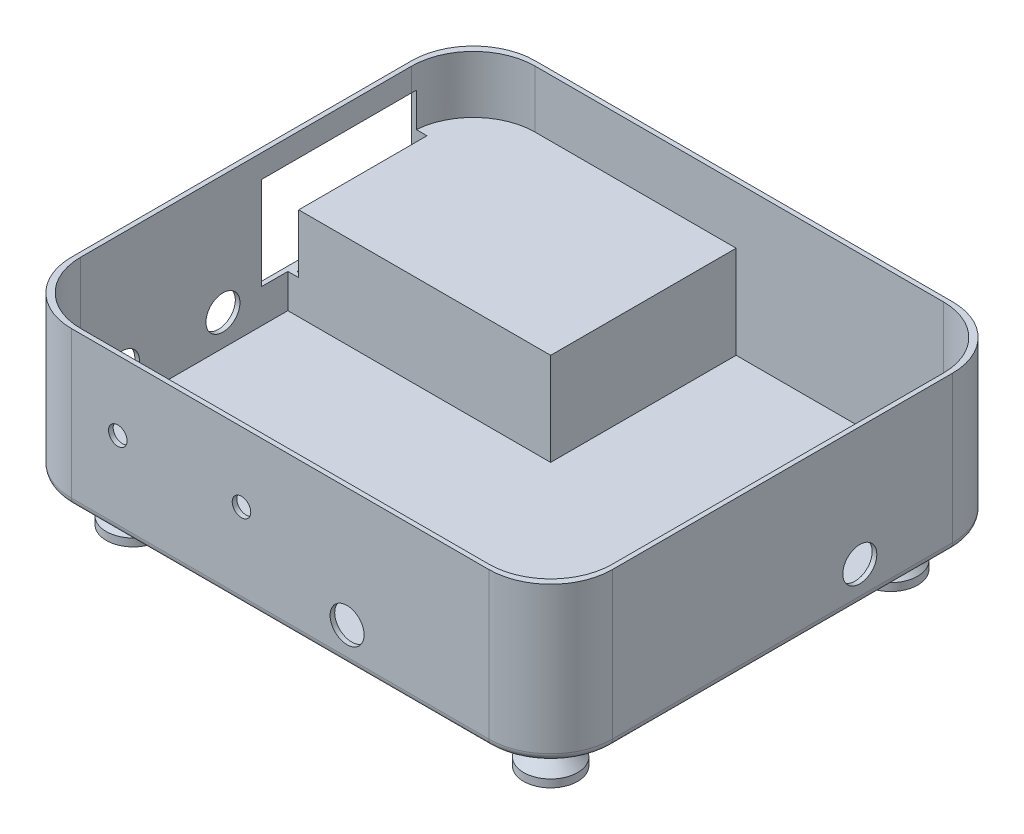
from build123d import *

# Parameters (mm, degrees)
SKETCH1_W             = 350
SKETCH1_H             = 300
BOSS_EXTRUDE1_DEPTH   = 100
SHELL1_T              = -3
SKETCH2_R             = 11
CUT_EXTRUDE1_DEPTH    = 10
SKETCH3_R             = 11
CUT_EXTRUDE2_DEPTH    = 10
SKETCH4_R             = 11
CUT_EXTRUDE3_DEPTH    = 10
FILLET1_R             = 40
FILLET2_R             = 5
SKETCH5_R             = 10
BOSS_EXTRUDE2_DEPTH   = 15
SKETCH6_R             = 17.5
BOSS_EXTRUDE3_DEPTH   = 15
CHAMFER1_SIZE         = 10
EXTRUDE_THIN1_DEPTH   = 10
EXTRUDE_THIN1_START   = 50
EXTRUDE_THIN1_2_DEPTH = 10
EXTRUDE_THIN1_START_2 = 10
EXTRUDE_THIN1_3_DEPTH = 40
SKETCH8_W             = 100
SKETCH8_H             = 60
CUT_EXTRUDE4_DEPTH    = 10
SKETCH9_R             = 6
CUT_EXTRUDE5_DEPTH    = 10


# Read off the part's stored shape, not the designer's step: Extrude-Thin1
with BuildPart() as part:
    # Sketch1 → Boss-Extrude1 (new body)
    with BuildSketch(Plane(origin=(0, 0, 0), x_dir=(1, 0, 0), z_dir=(0, 1, 0))):
        Rectangle(SKETCH1_W, SKETCH1_H)
    extrude(amount=BOSS_EXTRUDE1_DEPTH)

    # Shell1
    shell1_openings = [part.faces().sort_by_distance(p)[0] for p in [
        (0, 100, 0),
    ]]
    offset(amount=SHELL1_T, openings=shell1_openings, kind=Kind.INTERSECTION)

    # Sketch2 → Cut-Extrude1 (cut)
    with BuildSketch(Plane.ZY.offset(175)):
        with Locations((80, 23)):
            Circle(SKETCH2_R)
        with Locations((15, 23)):
            Circle(SKETCH2_R)
    extrude(amount=-CUT_EXTRUDE1_DEPTH, mode=Mode.SUBTRACT)

    # Sketch3 → Cut-Extrude2 (cut)
    with BuildSketch(Plane.XY.offset(150)):
        with Locations((43.31, 23)):
            Circle(SKETCH3_R)
    extrude(amount=-CUT_EXTRUDE2_DEPTH, mode=Mode.SUBTRACT)

    # Sketch4 → Cut-Extrude3 (cut)
    with BuildSketch(Plane(origin=(175, 0, 0), x_dir=(0, 0, -1), z_dir=(1, 0, 0))):
        with Locations((50, 23)):
            Circle(SKETCH4_R)
    extrude(amount=-CUT_EXTRUDE3_DEPTH, mode=Mode.SUBTRACT)

    # Fillet1
    fillet1_edges = [part.edges().sort_by_distance(p)[0] for p in [
        (172, 51.5, 147),
        (172, 51.5, -147),
        (-172, 51.5, -147),
        (-172, 51.5, 147),
        (175, 50, 150),
        (-175, 50, 150),
        (-175, 50, -150),
        (175, 50, -150),
    ]]
    fillet(fillet1_edges, radius=FILLET1_R)

    # Fillet2
    fillet2_edges = [part.edges().sort_by_distance(p)[0] for p in [
        (0, 0, -150),
        (175, 0, 0),
        (0, 0, 150),
        (-175, 0, 0),
        (-163.284271247, 0, 138.284271247),
        (163.284271247, 0, 138.284271247),
        (-163.284271247, 0, -138.284271247),
        (163.284271247, 0, -138.284271247),
    ]]
    fillet(fillet2_edges, radius=FILLET2_R)

    # Sketch5 → Boss-Extrude2 (add)
    with BuildSketch(Plane.XZ):
        with Locations(Location((-135, -110, 0), (0, 0, 90))):
            Circle(SKETCH5_R)
        with Locations(Location((-135, 110, 0), (0, 0, 90))):
            Circle(SKETCH5_R)
        with Locations(Location((135, -110, 0), (0, 0, 90))):
            Circle(SKETCH5_R)
        with Locations(Location((135, 110, 0), (0, 0, 90))):
            Circle(SKETCH5_R)
    extrude(amount=BOSS_EXTRUDE2_DEPTH)

    # Sketch6 → Boss-Extrude3 (add)
    with BuildSketch(Plane.XZ.offset(15)):
        with Locations(Location((135, 110, 0), (0, 0, 270))):
            Circle(SKETCH6_R)
        with Locations(Location((135, -110, 0), (0, 0, 270))):
            Circle(SKETCH6_R)
        with Locations(Location((-135, 110, 0), (0, 0, 270))):
            Circle(SKETCH6_R)
        with Locations(Location((-135, -110, 0), (0, 0, 270))):
            Circle(SKETCH6_R)
    extrude(amount=BOSS_EXTRUDE3_DEPTH)

    # Chamfer1
    # the kernel refuses this chamfer: 10 mm, written as the material it takes off along each edge
    with BuildSketch(Plane(origin=(-135, -15, -110), x_dir=(0, 0, -1), z_dir=(-1, 0, 0))) as chamfer1_piece_1_section:
        Polygon((17.5 - CHAMFER1_SIZE, 0), (17.5, CHAMFER1_SIZE), (17.5, 0), align=None)
    chamfer1_piece_1 = revolve(axis=Axis((-135, -15, -110), (0, -1, 0)), mode=Mode.PRIVATE)
    chamfer1_piece_1 = chamfer1_piece_1 - Plane(origin=(-135, -21.273186291, -110), x_dir=(0, 0, 1), z_dir=(0, 1, 0)) * Cylinder(10, 70, mode=Mode.PRIVATE)
    add(chamfer1_piece_1, mode=Mode.SUBTRACT)
    with BuildSketch(Plane(origin=(-135, -15, 110), x_dir=(0, 0, -1), z_dir=(-1, 0, 0))) as chamfer1_piece_2_section:
        Polygon((17.5 - CHAMFER1_SIZE, 0), (17.5, CHAMFER1_SIZE), (17.5, 0), align=None)
    chamfer1_piece_2 = revolve(axis=Axis((-135, -15, 110), (0, -1, 0)), mode=Mode.PRIVATE)
    chamfer1_piece_2 = chamfer1_piece_2 - Plane(origin=(-135, -21.273186291, 110), x_dir=(0, 0, 1), z_dir=(0, 1, 0)) * Cylinder(10, 70, mode=Mode.PRIVATE)
    add(chamfer1_piece_2, mode=Mode.SUBTRACT)
    with BuildSketch(Plane(origin=(135, -15, -110), x_dir=(0, 0, -1), z_dir=(-1, 0, 0))) as chamfer1_piece_3_section:
        Polygon((17.5 - CHAMFER1_SIZE, 0), (17.5, CHAMFER1_SIZE), (17.5, 0), align=None)
    chamfer1_piece_3 = revolve(axis=Axis((135, -15, -110), (0, -1, 0)), mode=Mode.PRIVATE)
    chamfer1_piece_3 = chamfer1_piece_3 - Plane(origin=(135, -21.273186291, -110), x_dir=(0, 0, 1), z_dir=(0, 1, 0)) * Cylinder(10, 71, mode=Mode.PRIVATE)
    add(chamfer1_piece_3, mode=Mode.SUBTRACT)
    with BuildSketch(Plane(origin=(135, -15, 110), x_dir=(0, 0, -1), z_dir=(-1, 0, 0))) as chamfer1_piece_4_section:
        Polygon((17.5, CHAMFER1_SIZE), (17.5 - CHAMFER1_SIZE, 0), (17.5, 0), align=None)
    chamfer1_piece_4 = revolve(axis=Axis((135, -15, 110), (0, -1, 0)), mode=Mode.PRIVATE)
    chamfer1_piece_4 = chamfer1_piece_4 - Plane(origin=(135, -21.273186291, 110), x_dir=(0, 0, 1), z_dir=(0, 1, 0)) * Cylinder(10, 71, mode=Mode.PRIVATE)
    add(chamfer1_piece_4, mode=Mode.SUBTRACT)

    # Extrude-Thin1 outline → Extrude-Thin1 (add)
    with BuildSketch(Plane(origin=(0, 3, 0), x_dir=(1, 0, 0), z_dir=(0, 1, 0))):
        with BuildLine():
            Line((-172, 27), (-2, 27))
            Line((-2, 27), (-2, 147))
            Line((-2, 147), (-132, 147))
            ThreePointArc((-132, 147), (-160.284271247, 135.284271247), (-172, 107))
            Line((-172, 107), (-172, 27))
        make_face()
    extrude(amount=EXTRUDE_THIN1_DEPTH)

    # Extrude-Thin1 2 outline → Extrude-Thin1 2 (add)
    with BuildSketch(Plane(origin=(0, 3, 0), x_dir=(1, 0, 0), z_dir=(0, 1, 0)).offset(EXTRUDE_THIN1_START)):
        with BuildLine():
            Line((-172, 27), (-2, 27))
            Line((-2, 27), (-2, 147))
            Line((-2, 147), (-132, 147))
            ThreePointArc((-132, 147), (-160.284271247, 135.284271247), (-172, 107))
            Line((-172, 107), (-172, 27))
        make_face()
    extrude(amount=EXTRUDE_THIN1_2_DEPTH)

    # Extrude-Thin1 3 outline → Extrude-Thin1 3 (add)
    with BuildSketch(Plane(origin=(0, 3, 0), x_dir=(1, 0, 0), z_dir=(0, 1, 0)).offset(EXTRUDE_THIN1_START_2)):
        with BuildLine():
            Line((-172, 27), (-2, 27))
            Line((-2, 27), (-2, 147))
            Line((-2, 147), (-132, 147))
            ThreePointArc((-132, 147), (-160.284271247, 135.284271247), (-172, 107))
            Line((-172, 107), (-172, 27))
        make_face()
        with BuildLine():
            ThreePointArc((-169, 107), (-158.162950904, 133.162950904), (-132, 144))
            Line((-132, 144), (-5, 144))
            Line((-5, 144), (-5, 30))
            Line((-5, 30), (-169, 30))
            Line((-169, 30), (-169, 107))
        make_face(mode=Mode.SUBTRACT)
    extrude(amount=EXTRUDE_THIN1_3_DEPTH)

    # Sketch8 → Cut-Extrude4 (cut)
    with BuildSketch(Plane.ZY.offset(175)):
        with Locations((-60, 55)):
            Rectangle(SKETCH8_W, SKETCH8_H)
    extrude(amount=-CUT_EXTRUDE4_DEPTH, mode=Mode.SUBTRACT)

    # Sketch9 → Cut-Extrude5 (cut)
    with BuildSketch(Plane.XY.offset(150)):
        with Locations((-105, 55)):
            Circle(SKETCH9_R)
        with Locations((-25, 55)):
            Circle(SKETCH9_R)
    extrude(amount=-CUT_EXTRUDE5_DEPTH, mode=Mode.SUBTRACT)


solid = part.part
